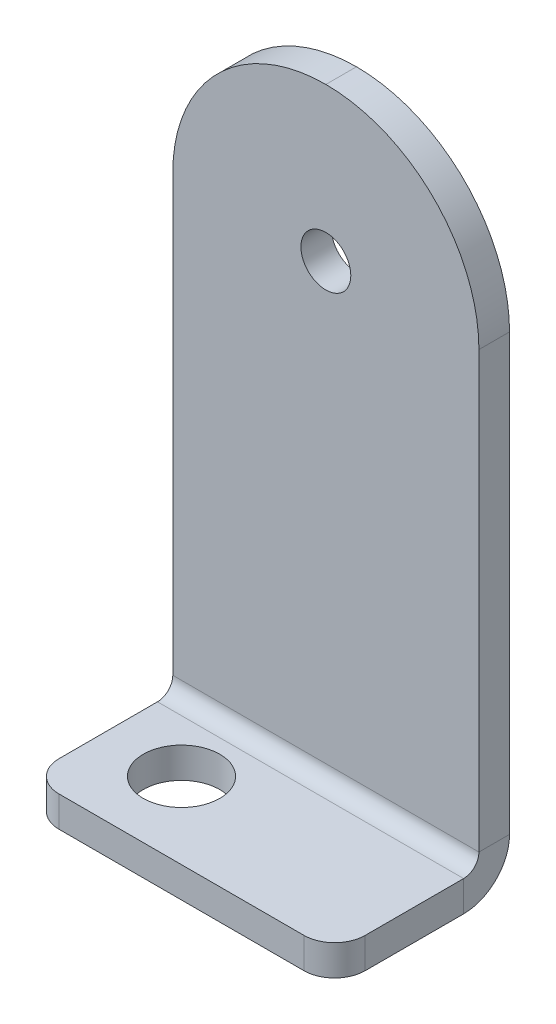
from build123d import *

# Parameters (mm, degrees)
SKETCH1_W                  = 25.4
SKETCH1_H                  = 63.5
SKETCH1_R                  = 2.0701
SKETCH1_R_2                = 3.175
BASE_FLANGE1_DEPTH         = 2.54
SKETCHED_START             = -25.4
SKETCHED_BEND1_DEPTH       = 25.4
SKETCHED_START_2           = -15.8749999
SKETCHED_BEND1_2_DEPTH     = 15.8749999
SKETCHED_BEND1_3_DEPTH     = 3.1749999
SKETCHED_START_3           = -22.2250001
SKETCHED_BEND1_4_DEPTH     = 6.3500002
SKETCHED_START_4           = 10.884911335
SKETCHED_BEND1_5_OUTLINE_R = 3.175
SKETCHED_BEND1_5_DEPTH     = 2.54
FILLET1_R                  = 12.7
FILLET2_R                  = 2.54


with BuildPart() as part:
    # Base-Flange1: sheet metal written as solids
    # Sketch1 → Base-Flange1 (new body)
    with BuildSketch(Plane.XY):
        with Locations((-12.7, 31.75)):
            Rectangle(SKETCH1_W, SKETCH1_H)
        with Locations((-12.7, 50.8)):
            Circle(SKETCH1_R, mode=Mode.SUBTRACT)
        with Locations((-19.05, 6.35)):
            Circle(SKETCH1_R_2, mode=Mode.SUBTRACT)
    extrude(amount=-BASE_FLANGE1_DEPTH)

    # Sketched Bend1: read off the stored shape, not the designer's step
    # Sketched Bend1 outline → Sketched Bend1 (cut)
    with BuildSketch(Plane.YZ.offset(SKETCHED_START)):
        with BuildLine():
            ThreePointArc((14.694911335, -2.54), (12.49520681, -1.840851973), (11.102808887, 0))
            Line((11.102808887, 0), (0, 0))
            Line((0, 0), (0, -2.54))
            Line((0, -2.54), (14.694911335, -2.54))
        make_face()
    extrude(amount=SKETCHED_BEND1_DEPTH, mode=Mode.SUBTRACT)

    # Sketched Bend1 2 outline → Sketched Bend1 2 (add)
    with BuildSketch(Plane.YZ.offset(SKETCHED_START_2)):
        with BuildLine():
            Line((10.884911335, 11.975088665), (10.884911335, 1.27))
            ThreePointArc((10.884911335, 1.27), (10.939780823, 0.625721461), (11.102808887, 0))
            Line((11.102808887, 0), (14.694911335, 0))
            ThreePointArc((14.694911335, 0), (13.796885723, 0.371974388), (13.424911335, 1.27))
            Line((13.424911335, 1.27), (13.424911335, 11.975088665))
            Line((13.424911335, 11.975088665), (10.884911335, 11.975088665))
        make_face()
    extrude(amount=SKETCHED_BEND1_2_DEPTH)

    # Sketched Bend1 3 outline → Sketched Bend1 3 (add)
    with BuildSketch(Plane.YZ.offset(SKETCHED_START)):
        with BuildLine():
            Line((10.884911335, 11.975088665), (10.884911335, 1.27))
            ThreePointArc((10.884911335, 1.27), (10.939780823, 0.625721461), (11.102808887, 0))
            Line((11.102808887, 0), (14.694911335, 0))
            ThreePointArc((14.694911335, 0), (13.796885723, 0.371974388), (13.424911335, 1.27))
            Line((13.424911335, 1.27), (13.424911335, 11.975088665))
            Line((13.424911335, 11.975088665), (10.884911335, 11.975088665))
        make_face()
    extrude(amount=SKETCHED_BEND1_3_DEPTH)

    # Sketched Bend1 4 outline → Sketched Bend1 4 (add)
    with BuildSketch(Plane.YZ.offset(SKETCHED_START_3)):
        with BuildLine():
            Line((10.884911335, 11.975088665), (10.884911335, 1.27))
            ThreePointArc((10.884911335, 1.27), (10.939780823, 0.625721461), (11.102808887, 0))
            Line((11.102808887, 0), (14.694911335, 0))
            ThreePointArc((14.694911335, 0), (13.796885723, 0.371974388), (13.424911335, 1.27))
            Line((13.424911335, 1.27), (13.424911335, 11.975088665))
            Line((13.424911335, 11.975088665), (10.884911335, 11.975088665))
        make_face()
    extrude(amount=SKETCHED_BEND1_4_DEPTH)

    # Sketched Bend1 5 outline → Sketched Bend1 5 (cut)
    with BuildSketch(Plane(origin=(0, 0, 0), x_dir=(1, 0, 0), z_dir=(0, 1, 0)).offset(SKETCHED_START_4)):
        with Locations((-19.05, -5.625088665)):
            Circle(SKETCHED_BEND1_5_OUTLINE_R)
    extrude(amount=SKETCHED_BEND1_5_DEPTH, mode=Mode.SUBTRACT)

    # Fillet1
    fillet1_edges = [part.edges().sort_by_distance(p)[0] for p in [
        (-25.4, 63.5, -1.27),
        (0, 63.5, -1.27),
    ]]
    fillet(fillet1_edges, radius=FILLET1_R - 0.0001)  # a hair under: the kernel refuses the full size

    # Fillet2
    fillet2_edges = [part.edges().sort_by_distance(p)[0] for p in [
        (0, 12.154911335, 11.975088665),
        (-25.4, 12.154911335, 11.975088665),
    ]]
    fillet(fillet2_edges, radius=FILLET2_R)


solid = part.part
